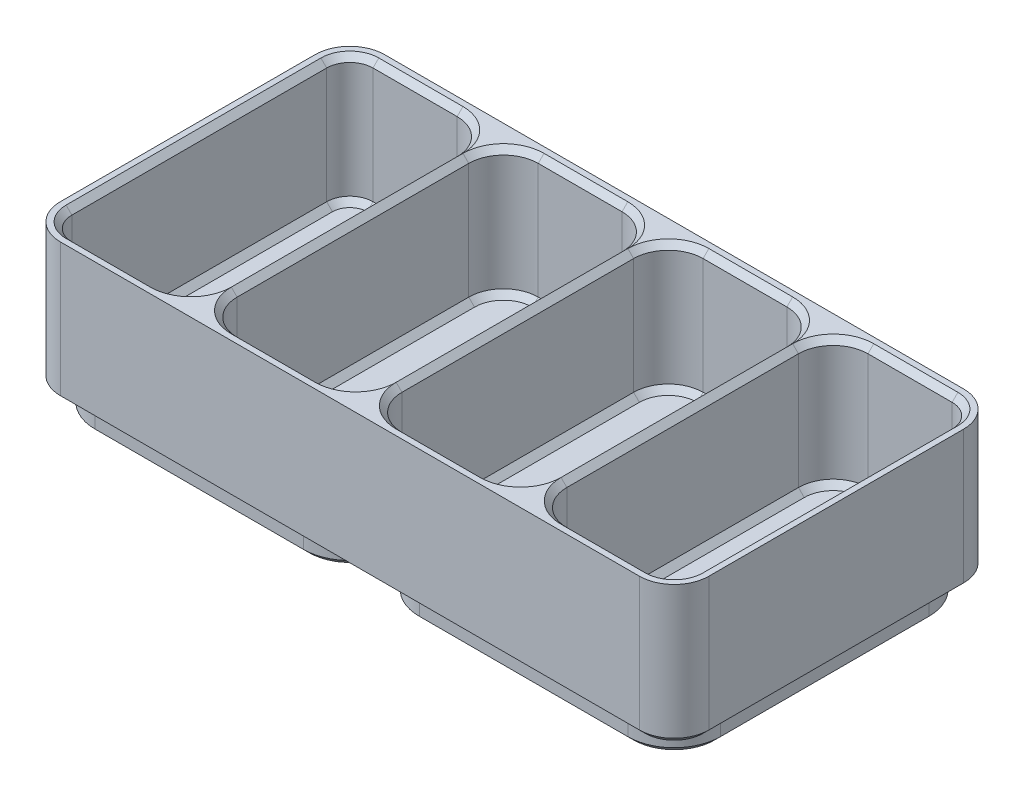
from build123d import *

# Parameters (mm, degrees)
BOSS_EXTRUDE4_DEPTH = 5
SKETCH6_W           = 70
SKETCH6_H           = 70
BOSS_EXTRUDE5_DEPTH = 30
SKETCH8_R           = 3
CUT_EXTRUDE1_DEPTH  = 2
FILLET1_R           = 7.5
SKETCH13_W          = 33.08628573
SKETCH13_H          = 65
CUT_EXTRUDE2_DEPTH  = 27.5
FILLET2_R           = 7.5
CHAMFER1_SIZE       = 1.25
CHAMFER2_SIZE       = 1.25


with BuildPart() as part:
    # Sketch5 → Boss-Extrude4 (new body)
    with BuildSketch(Plane(origin=(0, 0, 0), x_dir=(1, 0, 0), z_dir=(0, 1, 0))):
        with BuildLine():
            Line((-22.5, -32.5), (22.5, -32.5))
            ThreePointArc((22.5, -32.5), (29.571067812, -29.571067812), (32.5, -22.5))
            Line((32.5, -22.5), (32.5, 22.5))
            ThreePointArc((32.5, 22.5), (29.571067812, 29.571067812), (22.5, 32.5))
            Line((22.5, 32.5), (-22.5, 32.5))
            ThreePointArc((-22.5, 32.5), (-29.571067812, 29.571067812), (-32.5, 22.5))
            Line((-32.5, 22.5), (-32.5, -22.5))
            ThreePointArc((-32.5, -22.5), (-29.571067812, -29.571067812), (-22.5, -32.5))
        make_face()
    extrude(amount=BOSS_EXTRUDE4_DEPTH)

    # Sketch6 → Boss-Extrude5 (add)
    with BuildSketch(Plane(origin=(0, 5, 0), x_dir=(1, 0, 0), z_dir=(0, 1, 0))):
        Rectangle(SKETCH6_W, SKETCH6_H)
    extrude(amount=BOSS_EXTRUDE5_DEPTH)

    # Sketch8 → Cut-Extrude1 (cut)
    with BuildSketch(Plane.XZ):
        with Locations(Location((26.037533906, -26.035533906, 0), (0, 0, 270))):
            Circle(SKETCH8_R)
        with Locations(Location((26.036533906, 26.036533906, 0), (0, 0, 270))):
            Circle(SKETCH8_R)
        with BuildLine():
            ThreePointArc((-23.035533906, 26.035533906), (-24.887483609, 28.807172503), (-28.156854249, 28.156854249))
            Line((-28.156854249, 28.156854249), (-23.914213562, 23.914213562))
            ThreePointArc((-23.914213562, 23.914213562), (-23.263895308, 24.887483609), (-23.035533906, 26.035533906))
        make_face()
        with BuildLine():
            Line((-23.914213562, 23.914213562), (-28.156854249, 28.156854249))
            ThreePointArc((-28.156854249, 28.156854249), (-28.156854249, 23.914213562), (-23.914213562, 23.914213562))
        make_face()
        with Locations(Location((-26.034533906, -26.036533906, 0), (0, 0, 270))):
            Circle(SKETCH8_R)
    extrude(amount=-CUT_EXTRUDE1_DEPTH, mode=Mode.SUBTRACT)

    # Mirror1: part across plane


with BuildPart() as part_1:
    add(part.part)
    add(part.part.mirror(Plane(origin=(-35, 35, -35), x_dir=(0, 0, 1), z_dir=(1, 0, 0))))

    # Fillet1
    fillet1_edges = [part_1.edges().sort_by_distance(p)[0] for p in [
        (35, 20, 35),
        (35, 20, -35),
        (-105, 20, 35),
        (-105, 20, -35),
    ]]
    fillet(fillet1_edges, radius=FILLET1_R)

    # Sketch13 → Cut-Extrude2 (cut)
    with BuildSketch(Plane(origin=(0, 35, 0), x_dir=(1, 0, 0), z_dir=(0, 1, 0))):
        with BuildLine():
            Line((-97.5, -32.5), (-71.83628573, -32.5))
            Line((-71.83628573, -32.5), (-71.83628573, 32.5))
            Line((-71.83628573, 32.5), (-97.5, 32.5))
            ThreePointArc((-97.5, 32.5), (-101.035533906, 31.035533906), (-102.5, 27.5))
            Line((-102.5, 27.5), (-102.5, -27.5))
            ThreePointArc((-102.5, -27.5), (-101.035533906, -31.035533906), (-97.5, -32.5))
        make_face()
        with Locations((-52.793142865, 0)):
            Rectangle(SKETCH13_W, SKETCH13_H)
        with Locations((-17.206857135, 0)):
            Rectangle(SKETCH13_W, SKETCH13_H)
        with BuildLine():
            Line((1.83628573, 32.5), (1.83628573, -32.5))
            Line((1.83628573, -32.5), (27.5, -32.5))
            ThreePointArc((27.5, -32.5), (31.035533906, -31.035533906), (32.5, -27.5))
            Line((32.5, -27.5), (32.5, 27.5))
            ThreePointArc((32.5, 27.5), (31.035533906, 31.035533906), (27.5, 32.5))
            Line((27.5, 32.5), (1.83628573, 32.5))
        make_face()
    extrude(amount=-CUT_EXTRUDE2_DEPTH, mode=Mode.SUBTRACT)

    # Fillet2
    fillet2_edges = [part_1.edges().sort_by_distance(p)[0] for p in [
        (-71.83628573, 21.25, -32.5),
        (-71.83628573, 21.25, 32.5),
        (-36.25, 21.25, -32.5),
        (-36.25, 21.25, 32.5),
        (-69.33628573, 21.25, 32.5),
        (-69.33628573, 21.25, -32.5),
        (-0.66371427, 21.25, -32.5),
        (-0.66371427, 21.25, 32.5),
        (-33.75, 21.25, 32.5),
        (-33.75, 21.25, -32.5),
        (1.83628573, 21.25, 32.5),
        (1.83628573, 21.25, -32.5),
    ]]
    fillet(fillet2_edges, radius=FILLET2_R)

    # Chamfer1
    chamfer1_edges = [part_1.edges().sort_by_distance(p)[0] for p in [
        (-88.418142865, 7.5, 32.5),
        (-101.035533906, 7.5, 31.035533906),
        (-102.5, 7.5, 0),
        (-101.035533906, 7.5, -31.035533906),
        (-101.035533906, 35, -31.035533906),
        (-102.5, 35, 0),
        (-101.035533906, 35, 31.035533906),
        (-88.418142865, 35, 32.5),
        (18.418142865, 7.5, -32.5),
        (31.035533906, 7.5, -31.035533906),
        (32.5, 7.5, 0),
        (31.035533906, 7.5, 31.035533906),
        (31.035533906, 35, 31.035533906),
        (32.5, 35, 0),
        (31.035533906, 35, -31.035533906),
        (18.418142865, 35, -32.5),
        (-71.83628573, 35, 0),
        (-71.83628573, 7.5, 0),
        (-88.418142865, 7.5, -32.5),
        (-74.032984871, 7.5, -30.303300859),
        (-74.032984871, 7.5, 30.303300859),
        (-36.25, 35, 0),
        (-36.25, 7.5, 0),
        (-52.793142865, 35, 32.5),
        (-52.793142865, 7.5, 32.5),
        (-52.793142865, 7.5, -32.5),
        (-69.33628573, 7.5, 0),
        (-38.446699141, 7.5, -30.303300859),
        (-67.139586589, 7.5, -30.303300859),
        (-67.139586589, 7.5, 30.303300859),
        (-38.446699141, 7.5, 30.303300859),
        (-0.66371427, 35, 0),
        (-0.66371427, 7.5, 0),
        (-17.206857135, 35, 32.5),
        (-17.206857135, 7.5, 32.5),
        (-17.206857135, 7.5, -32.5),
        (-33.75, 7.5, 0),
        (-2.860413411, 7.5, -30.303300859),
        (-31.553300859, 7.5, -30.303300859),
        (-31.553300859, 7.5, 30.303300859),
        (-2.860413411, 7.5, 30.303300859),
        (-69.33628573, 35, 0),
        (-33.75, 35, 0),
        (18.418142865, 35, 32.5),
        (18.418142865, 7.5, 32.5),
        (1.83628573, 35, 0),
        (1.83628573, 7.5, 0),
        (4.032984871, 7.5, -30.303300859),
        (4.032984871, 7.5, 30.303300859),
        (-17.206857135, 35, -32.5),
        (-52.793142865, 35, -32.5),
        (-88.418142865, 35, -32.5),
        (-74.032984871, 35, 30.303300859),
        (-38.446699141, 35, 30.303300859),
        (-2.860413411, 35, 30.303300859),
        (-67.139586589, 35, 30.303300859),
        (-31.553300859, 35, 30.303300859),
        (4.032984871, 35, 30.303300859),
        (4.032984871, 35, -30.303300859),
        (-31.553300859, 35, -30.303300859),
        (-67.139586589, 35, -30.303300859),
        (-2.860413411, 35, -30.303300859),
        (-38.446699141, 35, -30.303300859),
        (-74.032984871, 35, -30.303300859),
    ]]
    chamfer(chamfer1_edges, length=CHAMFER1_SIZE - 0.0001)  # a hair under: the kernel refuses the full size

    # Chamfer2
    chamfer2_edges = [part_1.edges().sort_by_distance(p)[0] for p in [
        (32.5, 0, 0),
        (-35, 5, -35),
        (29.571067812, 0, 29.571067812),
        (-35, 5, 35),
        (-105, 5, 0),
        (35, 5, 0),
        (-102.803300859, 5, -32.803300859),
        (0, 0, 32.5),
        (-102.803300859, 5, 32.803300859),
        (32.803300859, 5, 32.803300859),
        (32.803300859, 5, -32.803300859),
        (-29.571067812, 0, 29.571067812),
        (-40.428932188, 0, 29.571067812),
        (-70, 0, 32.5),
        (-99.571067812, 0, 29.571067812),
        (-102.5, 0, 0),
        (-99.571067812, 0, -29.571067812),
        (-70, 0, -32.5),
        (-40.428932188, 0, -29.571067812),
        (-37.5, 0, 0),
        (-32.5, 0, 0),
        (-29.571067812, 0, -29.571067812),
        (0, 0, -32.5),
        (29.571067812, 0, -29.571067812),
    ]]
    chamfer(chamfer2_edges, length=CHAMFER2_SIZE)


solid = part_1.part
